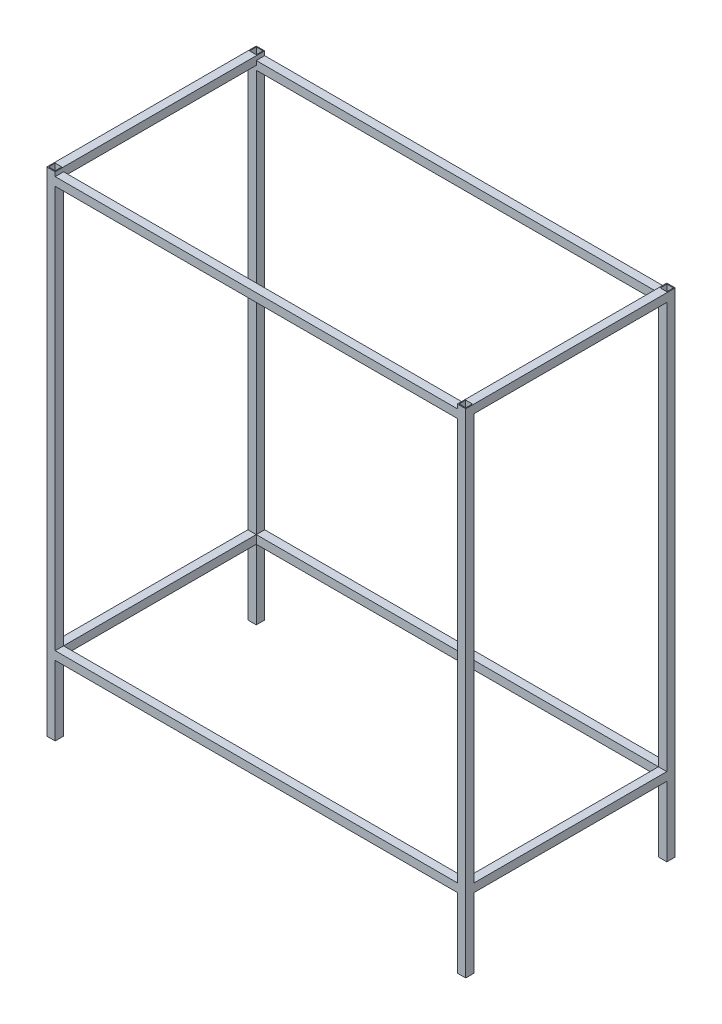
from build123d import *

# Parameters (mm, degrees)
SKETCH_1_W          = 1440
SKETCH_1_H          = 1440
EXTRUDE_1_DEPTH     = 750
SKETCH_2_W          = 690
SKETCH_2_H          = 1455
CUT_EXTRUDE_1_DEPTH = 2435.691972304
SKETCH_3_W          = 1440
SKETCH_3_H          = 690
CUT_EXTRUDE_2_DEPTH = 2424.839928708
SKETCH_4_W          = 24
SKETCH_4_H          = 24
CUT_EXTRUDE_3_DEPTH = 2435.691972304
SKETCH_5_W          = 690
SKETCH_5_H          = 250
CUT_EXTRUDE_4_DEPTH = 2435.691972304


with BuildPart() as part:
    # Эскиз1 → Бобышка-Вытянуть1 (new body)
    with BuildSketch(Plane.XY):
        Polygon((30, 1765), (30, 1750), (1470, 1750), (1470, 1765), (1500, 1765), (1500, 0), (1470, 0), (1470, 250), (30, 250), (30, 0), (0, 0), (0, 1765), align=None)
        with Locations((750, 1000)):
            Rectangle(SKETCH_1_W, SKETCH_1_H, mode=Mode.SUBTRACT)
    extrude(amount=EXTRUDE_1_DEPTH)

    # Эскиз2 → Вырез-Вытянуть1 (cut, through all)
    with BuildSketch(Plane(origin=(1500, 0, 0), x_dir=(0, 0, -1), z_dir=(1, 0, 0))):
        with Locations((-375, 1007.5)):
            Rectangle(SKETCH_2_W, SKETCH_2_H)
    extrude(amount=-CUT_EXTRUDE_1_DEPTH, mode=Mode.SUBTRACT)

    # Эскиз3 → Вырез-Вытянуть2 (cut, through all)
    with BuildSketch(Plane(origin=(0, 1750, 0), x_dir=(1, 0, 0), z_dir=(0, 1, 0))):
        with Locations((750, -375)):
            Rectangle(SKETCH_3_W, SKETCH_3_H)
    extrude(amount=-CUT_EXTRUDE_2_DEPTH, mode=Mode.SUBTRACT)

    # Эскиз4 → Вырез-Вытянуть3 (cut, through all)
    with BuildSketch(Plane(origin=(0, 1765, 0), x_dir=(1, 0, 0), z_dir=(0, 1, 0))):
        with Locations((15, -15)):
            Rectangle(SKETCH_4_W, SKETCH_4_H)
        with Locations((1485, -735)):
            Rectangle(SKETCH_4_W, SKETCH_4_H)
        with Locations((1485, -15)):
            Rectangle(SKETCH_4_W, SKETCH_4_H)
        with Locations((15, -735)):
            Rectangle(SKETCH_4_W, SKETCH_4_H)
    extrude(amount=-CUT_EXTRUDE_3_DEPTH, mode=Mode.SUBTRACT)

    # Эскиз5 → Вырез-Вытянуть4 (cut, through all)
    with BuildSketch(Plane(origin=(1500, 0, 0), x_dir=(0, 0, -1), z_dir=(1, 0, 0))):
        with Locations((-375, 125)):
            Rectangle(SKETCH_5_W, SKETCH_5_H)
    extrude(amount=-CUT_EXTRUDE_4_DEPTH, mode=Mode.SUBTRACT)


solid = part.part
